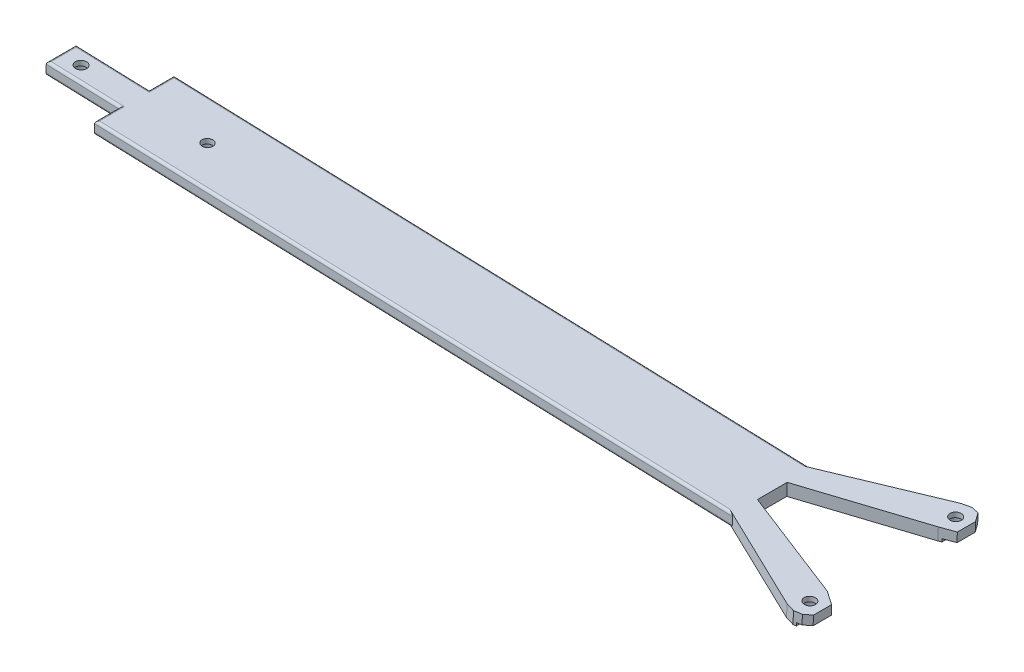
from build123d import *

# Parameters (mm, degrees)
SKETCH1_R           = 1.15
SKETCH1_R_2         = 1.1
BOSS_EXTRUDE1_DEPTH = 2.5
SKETCH2_R           = 2.1
CUT_EXTRUDE1_DEPTH  = 1.5
SKETCH3_W           = 95.504738846
SKETCH3_H           = 6
BOSS_EXTRUDE2_DEPTH = 1.5
FILLET1_R           = 0.5
FILLET2_R           = 0.5
CUT_EXTRUDE2_DEPTH  = 0.6


with BuildPart() as part:
    # Sketch1 → Boss-Extrude1 (new body)
    with BuildSketch(Plane(origin=(0.142209029, 4.250598455, 0), x_dir=(0.9994408094935507, -0.033437528600004186, 0), z_dir=(-0.033437528600004186, -0.9994408094935509, 0))):
        Polygon((16.139656986, 116.200036844), (18.863626106, 118.020989759), (18.863625946, 121.688114759), (17.639656986, 122.700036844), (16.139656986, 123.000036844), (14.335803078, 122.500036844), (-6.136373974, 113.00003089), (-134.806739216, 113.00003089), (-134.806739216, 108.000029776), (-149.556569968, 108.000029776), (-149.556569968, 102.000029776), (-134.806740003, 102.000029776), (-134.806740003, 97.00003089), (-6.136373974, 97.00003089), (14.339658272, 87.500036844), (16.139658272, 87.000036844), (17.639656986, 87.300036844), (18.863627375, 89.020989759), (18.863627214, 92.688114759), (16.139658272, 93.800036844), (-6.136373974, 102.00003089), (-6.136373974, 108.00003089), align=None)
        with Locations((16.139656986, 119.700036844)):
            Circle(SKETCH1_R, mode=Mode.SUBTRACT)
        with Locations((16.139658272, 90.300036844)):
            Circle(SKETCH1_R, mode=Mode.SUBTRACT)
        with Locations((-145.556569968, 105.000029776)):
            Circle(SKETCH1_R, mode=Mode.SUBTRACT)
        with Locations((-120.056569968, 105.00003089)):
            Circle(SKETCH1_R_2, mode=Mode.SUBTRACT)
    extrude(amount=BOSS_EXTRUDE1_DEPTH)

    # Sketch2 → Cut-Extrude1 (cut)
    with BuildSketch(Plane(origin=(0.058615208, 1.751996431, 0), x_dir=(0.9994408094935507, -0.03343752860000422, 0), z_dir=(-0.03343752860000422, -0.9994408094935509, 0))):
        with Locations((-145.534940255, 104.921602626)):
            Circle(SKETCH2_R)
        with Locations((-120.056569968, 105.00003089)):
            Circle(SKETCH2_R)
        with Locations((16.139656986, 119.700036844)):
            Circle(SKETCH2_R)
        with Locations((16.139658272, 90.300036844)):
            Circle(SKETCH2_R)
    extrude(amount=-CUT_EXTRUDE1_DEPTH, mode=Mode.SUBTRACT)

    # Sketch3 → Boss-Extrude2 (add)
    with BuildSketch(Plane(origin=(0.058615208, 1.751996431, 0), x_dir=(0.9994408094935507, -0.03343752860000421, 0), z_dir=(-0.03343752860000421, -0.9994408094935509, 0))):
        with Locations((-66.082119318, 105.00003089)):
            Rectangle(SKETCH3_W, SKETCH3_H)
    extrude(amount=BOSS_EXTRUDE2_DEPTH)

    # Fillet1
    fillet1_edges = [part.edges().sort_by_distance(p)[0] for p in [
        (-65.986551616, 3.961619186, 108.00003089),
        (-113.712218368, 5.558340404, 105.00003089),
        (-18.260884865, 2.364897967, 105.00003089),
        (-65.986551616, 3.961619186, 102.00003089),
        (-18.311041158, 0.865736753, 105.00003089),
        (-66.036707909, 2.462457971, 108.00003089),
        (-113.762374661, 4.05917919, 105.00003089),
        (-66.036707909, 2.462457971, 102.00003089),
    ]]
    fillet(fillet1_edges, radius=FILLET1_R)

    # Fillet2
    fillet2_edges = [part.edges().sort_by_distance(p)[0] for p in [
        (-141.959939325, 9.00480161, 102.000029776),
        (-149.330730325, 9.25140054, 105.000029776),
        (-141.959938931, 9.004801596, 108.000029776),
        (-134.589147538, 8.758202653, 110.500030333),
        (-134.589148324, 8.758202679, 99.500030333),
        (-70.28994054, 6.606993144, 113.00003089),
        (-70.289940933, 6.606993157, 97.00003089),
        (-134.672742146, 6.259600655, 99.500030333),
        (-70.373534755, 4.108391133, 97.00003089),
        (-70.373534362, 4.10839112, 113.00003089),
        (-134.672741359, 6.259600629, 110.500030333),
        (-142.043532753, 6.506199573, 108.000029776),
        (-149.414324146, 6.752798517, 105.000029776),
        (-142.043533146, 6.506199586, 102.000029776),
    ]]
    fillet(fillet2_edges, radius=FILLET2_R)

    # Sketch4 → Cut-Extrude2 (cut)
    with BuildSketch(Plane(origin=(0.058615208, 1.751996431, 0), x_dir=(0.9994408094935507, -0.03343752860000421, 0), z_dir=(-0.03343752860000421, -0.9994408094935509, 0))):
        with BuildLine():
            Line((16.703510277, 116.576968537), (18.863626106, 118.020989759))
            Line((18.863626106, 118.020989759), (18.863625946, 121.688114759))
            Line((18.863625946, 121.688114759), (17.639656986, 122.700036844))
            Line((17.639656986, 122.700036844), (16.703510277, 122.887266185))
            Line((16.703510277, 122.887266185), (16.703510277, 121.722923263))
            ThreePointArc((16.703510277, 121.722923263), (18.239656986, 119.700036844), (16.703510277, 117.677150424))
            Line((16.703510277, 117.677150424), (16.703510277, 116.576968537))
        make_face()
        with BuildLine():
            Line((18.863627375, 89.020989759), (18.863627214, 92.688114759))
            Line((18.863627214, 92.688114759), (16.703510277, 93.569872877))
            Line((16.703510277, 93.569872877), (16.703510277, 92.322923622))
            ThreePointArc((16.703510277, 92.322923622), (18.239658272, 90.300036844), (16.703510277, 88.277150066))
            Line((16.703510277, 88.277150066), (16.703510277, 87.112807341))
            Line((16.703510277, 87.112807341), (17.639656986, 87.300036844))
            Line((17.639656986, 87.300036844), (18.863627375, 89.020989759))
        make_face()
    extrude(amount=-CUT_EXTRUDE2_DEPTH, mode=Mode.SUBTRACT)


solid = part.part
